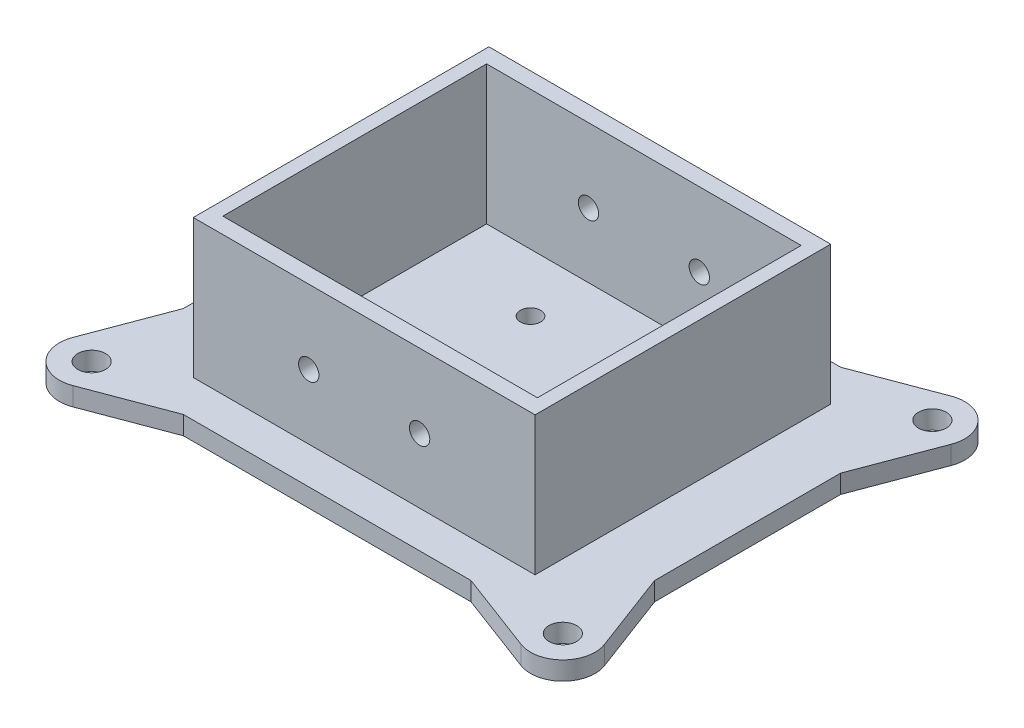
from build123d import *

# Parameters (mm, degrees)
SKETCH1_R               = 1.5
BOSS_EXTRUDE2_DEPTH     = 2
SKETCH2_W               = 37
SKETCH2_H               = 32
SKETCH2_W_2             = 34.05
SKETCH2_H_2             = 28.55
BOSS_EXTRUDE3_DEPTH     = 15
CUT_EXTRUDE1_DEPTH      = 40
CUT_EXTRUDE1_DEPTH_BACK = 11
SKETCH3_R               = 1.1
SKETCH2_4_R             = 1.1
CUT_EXTRUDE2_DEPTH      = 11


with BuildPart() as part:
    # Sketch1 → Boss-Extrude2 (new body)
    with BuildSketch(Plane(origin=(0, 0, 0), x_dir=(1, 0, 0), z_dir=(0, 1, 0))):
        with BuildLine():
            Line((-24.266499455, 23.2754353), (-15.568913997, 20))
            Line((-15.568913997, 20), (15.568913997, 20))
            Line((15.568913997, 20), (24.266499455, 23.2754353))
            ThreePointArc((24.266499455, 23.2754353), (27.974873734, 22.474873734), (28.7754353, 18.766499455))
            Line((28.7754353, 18.766499455), (25.5, 10.068913997))
            Line((25.5, 10.068913997), (25.5, -10.068913997))
            Line((25.5, -10.068913997), (28.7754353, -18.766499455))
            ThreePointArc((28.7754353, -18.766499455), (27.974873734, -22.474873734), (24.266499455, -23.2754353))
            Line((24.266499455, -23.2754353), (15.568913997, -20))
            Line((15.568913997, -20), (-15.568913997, -20))
            Line((-15.568913997, -20), (-24.266499455, -23.2754353))
            ThreePointArc((-24.266499455, -23.2754353), (-27.974873734, -22.474873734), (-28.7754353, -18.766499455))
            Line((-28.7754353, -18.766499455), (-25.5, -10.068913997))
            Line((-25.5, -10.068913997), (-25.5, 10.068913997))
            Line((-25.5, 10.068913997), (-28.7754353, 18.766499455))
            ThreePointArc((-28.7754353, 18.766499455), (-27.974873734, 22.474873734), (-24.266499455, 23.2754353))
        make_face()
        with Locations((-25.5, 20)):
            Circle(SKETCH1_R, mode=Mode.SUBTRACT)
        with Locations((25.5, 20)):
            Circle(SKETCH1_R, mode=Mode.SUBTRACT)
        with Locations((25.5, -20)):
            Circle(SKETCH1_R, mode=Mode.SUBTRACT)
        with Locations((-25.5, -20)):
            Circle(SKETCH1_R, mode=Mode.SUBTRACT)
    extrude(amount=BOSS_EXTRUDE2_DEPTH)

    # Sketch2 → Boss-Extrude3 (add)
    with BuildSketch(Plane(origin=(0, 2, 0), x_dir=(1, 0, 0), z_dir=(0, 1, 0))):
        Rectangle(SKETCH2_W, SKETCH2_H)
        Rectangle(SKETCH2_W_2, SKETCH2_H_2, mode=Mode.SUBTRACT)
    extrude(amount=BOSS_EXTRUDE3_DEPTH)

    # Sketch3 → Cut-Extrude1 (cut, two sides: drawn at the far end of the back side and taken through both)
    with BuildSketch(Plane.XY.offset(-14.275).offset(-CUT_EXTRUDE1_DEPTH_BACK)):
        with Locations((-6, 9)):
            Circle(SKETCH3_R)
        with Locations((6, 9)):
            Circle(SKETCH3_R)
    extrude(amount=CUT_EXTRUDE1_DEPTH + CUT_EXTRUDE1_DEPTH_BACK, mode=Mode.SUBTRACT)

    # Sketch2<4> → Cut-Extrude2 (cut)
    with BuildSketch(Plane(origin=(0, 2, 0), x_dir=(1, 0, 0), z_dir=(0, 1, 0))):
        with Locations((-6, 8)):
            Circle(SKETCH2_4_R)
        with Locations((6, 8)):
            Circle(SKETCH2_4_R)
        with Locations((6, -8)):
            Circle(SKETCH2_4_R)
        with Locations((-6, -8)):
            Circle(SKETCH2_4_R)
    extrude(amount=-CUT_EXTRUDE2_DEPTH, mode=Mode.SUBTRACT)


solid = part.part
